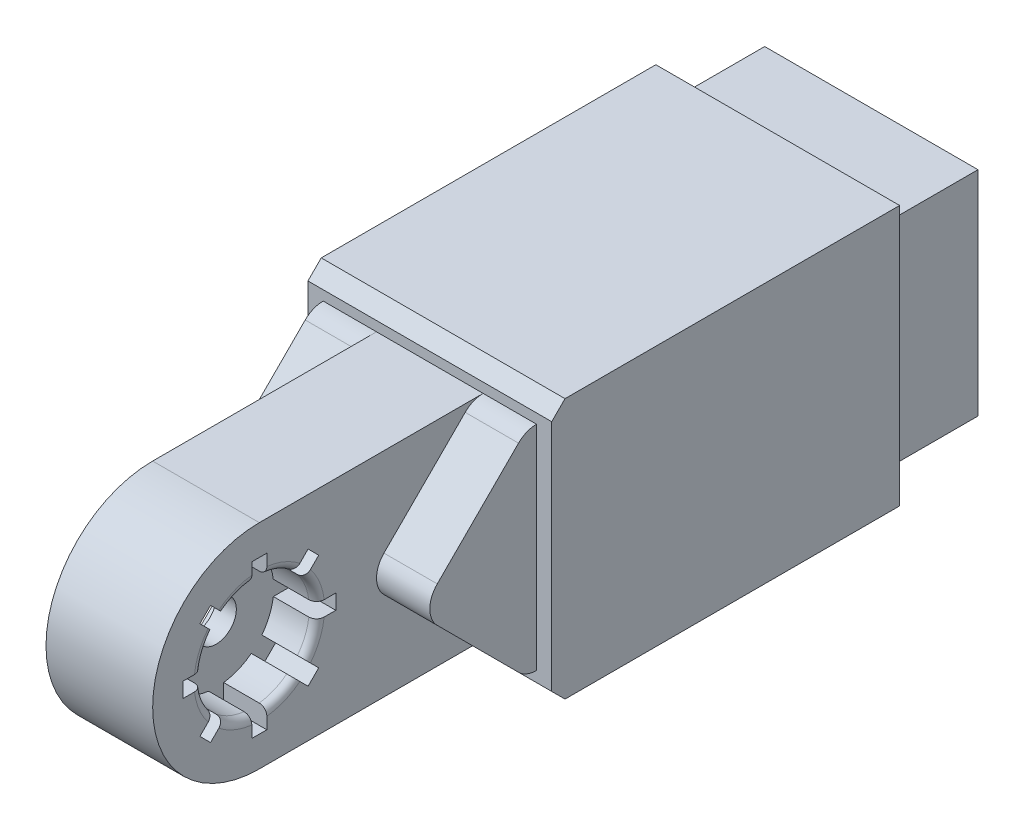
from build123d import *

# Parameters (mm, degrees)
SKETCH2_W                = 42
SKETCH2_H                = 42
BOSS_EXTRUDE1_DEPTH      = 89
SKETCH3_W                = 21
SKETCH3_H                = 42
BOSS_EXTRUDE2_DEPTH      = 42
BOSS_EXTRUDE3_DEPTH      = 21
SKETCH9_R                = 11.35
CUT_EXTRUDE2_DEPTH       = 8.5
CUT_EXTRUDE3_START       = -8.5
SKETCH11_R               = 11.35
CUT_EXTRUDE3_DEPTH       = 8.5
SKETCH12_R               = 3.975
CUT_EXTRUDE4_DEPTH       = 156.157984003
BOSS_EXTRUDE4_DEPTH      = 10.5
BOSS_EXTRUDE4_DEPTH_BACK = 31.5
FILLET1_R                = 5
FILLET2_R                = 5
FILLET3_R                = 5
FILLET4_R                = 5
FILLET5_R                = 5
FILLET6_R                = 5
FILLET7_R                = 1.5
FILLET8_R                = 1.5
SKETCH21_W               = 2.95860585
SKETCH21_H               = 4.417
CUT_EXTRUDE5_DEPTH       = 8.5
CIRPATTERN2_COUNT        = 8
MIRROR1_COPY_1_SKETCH_W  = 2.95860585
MIRROR1_COPY_1_SKETCH_H  = 4.417
MIRROR1_COPY_1_DEPTH     = 8.5
MIRROR1_COPY_2_SKETCH_W  = 2.95860585
MIRROR1_COPY_2_SKETCH_H  = 4.417
MIRROR1_COPY_2_DEPTH     = 8.5
MIRROR1_COPY_3_SKETCH_W  = 2.95860585
MIRROR1_COPY_3_SKETCH_H  = 4.417
MIRROR1_COPY_3_DEPTH     = 8.5
MIRROR1_COPY_4_SKETCH_W  = 2.95860585
MIRROR1_COPY_4_SKETCH_H  = 4.417
MIRROR1_COPY_4_DEPTH     = 8.5
MIRROR1_COPY_5_SKETCH_W  = 2.95860585
MIRROR1_COPY_5_SKETCH_H  = 4.417
MIRROR1_COPY_5_DEPTH     = 8.5
MIRROR1_COPY_6_SKETCH_W  = 2.95860585
MIRROR1_COPY_6_SKETCH_H  = 4.417
MIRROR1_COPY_6_DEPTH     = 8.5
MIRROR1_COPY_7_SKETCH_W  = 2.95860585
MIRROR1_COPY_7_SKETCH_H  = 4.417
MIRROR1_COPY_7_DEPTH     = 8.5
MIRROR1_COPY_8_SKETCH_W  = 2.95860585
MIRROR1_COPY_8_SKETCH_H  = 4.417
MIRROR1_COPY_8_DEPTH     = 8.5
SKETCH24_W               = 86.928932188
SKETCH24_H               = 4.545220174
SKETCH24_H_2             = 4.689106432
BOSS_EXTRUDE6_DEPTH      = 42
SKETCH25_W               = 68.5
SKETCH25_H               = 51.234326606
BOSS_EXTRUDE7_DEPTH      = 3
SKETCH28_W               = 68.5
SKETCH28_H               = 51.234326606
BOSS_EXTRUDE8_DEPTH      = 3
SKETCH30_W               = 62
SKETCH30_H               = 41.004326606
CUT_EXTRUDE6_DEPTH       = 45
SKETCH31_W               = 18.428932188
SKETCH31_H               = 4.615
CUT_EXTRUDE7_DEPTH       = 161.589321529
CHAMFER1_SIZE            = 1.5
SKETCH32_W               = 30
SKETCH32_H               = 30
CUT_EXTRUDE8_DEPTH       = 16.8
SKETCH33_R               = 5
CUT_EXTRUDE9_DEPTH       = 16.8
CUT_EXTRUDE10_DEPTH      = 162.455660134


with BuildPart() as part:
    # Sketch2 → Boss-Extrude1 (new body)
    with BuildSketch(Plane.XY):
        Rectangle(SKETCH2_W, SKETCH2_H)
    extrude(amount=BOSS_EXTRUDE1_DEPTH)

    # Sketch3 → Boss-Extrude2 (add)
    with BuildSketch(Plane.XY.offset(89)):
        Rectangle(SKETCH3_W, SKETCH3_H)
    extrude(amount=BOSS_EXTRUDE2_DEPTH)

    # Sketch8 → Boss-Extrude3 (add)
    with BuildSketch(Plane.ZY.offset(10.5)):
        with BuildLine():
            Line((131, 21), (131, -21))
            ThreePointArc((131, -21), (152, 0), (131, 21))
        make_face()
    extrude(amount=-BOSS_EXTRUDE3_DEPTH)

    # Sketch9 → Cut-Extrude2 (cut)
    with BuildSketch(Plane.ZY.offset(10.5)):
        with Locations((131, 0)):
            Circle(SKETCH9_R)
    extrude(amount=-CUT_EXTRUDE2_DEPTH, mode=Mode.SUBTRACT)

    # Sketch11 → Cut-Extrude3 (cut)
    with BuildSketch(Plane(origin=(10.5, 0, 0), x_dir=(0, 0, -1), z_dir=(1, 0, 0)).offset(CUT_EXTRUDE3_START)):
        with Locations((-131, 0)):
            Circle(SKETCH11_R)
    extrude(amount=CUT_EXTRUDE3_DEPTH, mode=Mode.SUBTRACT)

    # Sketch12 → Cut-Extrude4 (cut, through all)
    with BuildSketch(Plane.ZY.offset(2)):
        with Locations((131, 0)):
            Circle(SKETCH12_R)
    extrude(amount=-CUT_EXTRUDE4_DEPTH, mode=Mode.SUBTRACT)

    # Sketch20 → Boss-Extrude4 (add, two sides: drawn at the far end of the back side and taken through both)
    with BuildSketch(Plane.ZY.offset(10.5).offset(-BOSS_EXTRUDE4_DEPTH_BACK)):
        Polygon((89, -21), (110, 0), (89, 21), align=None)
    extrude(amount=BOSS_EXTRUDE4_DEPTH + BOSS_EXTRUDE4_DEPTH_BACK)

    # Fillet1
    fillet1_edges = [part.edges().sort_by_distance(p)[0] for p in [
        (15.75, 0, 110),
    ]]
    fillet(fillet1_edges, radius=FILLET1_R)

    # Fillet2
    fillet2_edges = [part.edges().sort_by_distance(p)[0] for p in [
        (-15.75, 0, 110),
    ]]
    fillet(fillet2_edges, radius=FILLET2_R)

    # Fillet3
    fillet3_edges = [part.edges().sort_by_distance(p)[0] for p in [
        (-15.75, -21, 89),
    ]]
    fillet(fillet3_edges, radius=FILLET3_R)

    # Fillet4
    fillet4_edges = [part.edges().sort_by_distance(p)[0] for p in [
        (-15.75, 21, 89),
    ]]
    fillet(fillet4_edges, radius=FILLET4_R)

    # Fillet5
    fillet5_edges = [part.edges().sort_by_distance(p)[0] for p in [
        (15.75, -21, 89),
    ]]
    fillet(fillet5_edges, radius=FILLET5_R)

    # Fillet6
    fillet6_edges = [part.edges().sort_by_distance(p)[0] for p in [
        (15.75, 21, 89),
    ]]
    fillet(fillet6_edges, radius=FILLET6_R)

    # Fillet7
    fillet7_edges = [part.edges().sort_by_distance(p)[0] for p in [
        (-10.5, 0, 119.65),
    ]]
    fillet(fillet7_edges, radius=FILLET7_R)

    # Fillet8
    fillet8_edges = [part.edges().sort_by_distance(p)[0] for p in [
        (10.5, 0, 142.35),
    ]]
    fillet(fillet8_edges, radius=FILLET8_R)

    # Sketch21 → Cut-Extrude5 (cut)
    with BuildSketch(Plane.ZY.offset(10.5)):
        with Locations((131, 12.85)):
            Rectangle(SKETCH21_W, SKETCH21_H)
    cut_extrude5 = extrude(amount=-CUT_EXTRUDE5_DEPTH, mode=Mode.SUBTRACT)

    # CirPattern2: Cut-Extrude5 ×8 about axis
    cirpattern2_axis = Axis((-9, 0, 131), (-1, 0, 0))
    for i in range(1, CIRPATTERN2_COUNT):
        add(cut_extrude5.rotate(cirpattern2_axis, i * 360 / CIRPATTERN2_COUNT), mode=Mode.SUBTRACT)

    # Mirror1 copy 1 sketch → Mirror1 copy 1 (cut)
    with BuildSketch(Plane(origin=(10.5, -92.630988335, 38.369011665), x_dir=(0, 0.7071067811865475, 0.7071067811865476), z_dir=(1, 0, 0))):
        with Locations((131, -12.85)):
            Rectangle(MIRROR1_COPY_1_SKETCH_W, MIRROR1_COPY_1_SKETCH_H)
    extrude(amount=-MIRROR1_COPY_1_DEPTH, mode=Mode.SUBTRACT)

    # Mirror1 copy 2 sketch → Mirror1 copy 2 (cut)
    with BuildSketch(Plane(origin=(10.5, -131, 131), x_dir=(0, 1, 0), z_dir=(1, 0, 0))):
        with Locations((131, -12.85)):
            Rectangle(MIRROR1_COPY_2_SKETCH_W, MIRROR1_COPY_2_SKETCH_H)
    extrude(amount=-MIRROR1_COPY_2_DEPTH, mode=Mode.SUBTRACT)

    # Mirror1 copy 3 sketch → Mirror1 copy 3 (cut)
    with BuildSketch(Plane(origin=(10.5, -92.630988335, 223.630988335), x_dir=(0, 0.7071067811865476, -0.7071067811865475), z_dir=(1, 0, 0))):
        with Locations((131, -12.85)):
            Rectangle(MIRROR1_COPY_3_SKETCH_W, MIRROR1_COPY_3_SKETCH_H)
    extrude(amount=-MIRROR1_COPY_3_DEPTH, mode=Mode.SUBTRACT)

    # Mirror1 copy 4 sketch → Mirror1 copy 4 (cut)
    with BuildSketch(Plane(origin=(10.5, 0, 262), x_dir=(0, 0, -1), z_dir=(1, 0, 0))):
        with Locations((131, -12.85)):
            Rectangle(MIRROR1_COPY_4_SKETCH_W, MIRROR1_COPY_4_SKETCH_H)
    extrude(amount=-MIRROR1_COPY_4_DEPTH, mode=Mode.SUBTRACT)

    # Mirror1 copy 5 sketch → Mirror1 copy 5 (cut)
    with BuildSketch(Plane(origin=(10.5, 92.630988335, 223.630988335), x_dir=(0, -0.7071067811865475, -0.7071067811865477), z_dir=(1, 0, 0))):
        with Locations((131, -12.85)):
            Rectangle(MIRROR1_COPY_5_SKETCH_W, MIRROR1_COPY_5_SKETCH_H)
    extrude(amount=-MIRROR1_COPY_5_DEPTH, mode=Mode.SUBTRACT)

    # Mirror1 copy 6 sketch → Mirror1 copy 6 (cut)
    with BuildSketch(Plane(origin=(10.5, 131, 131), x_dir=(0, -1, 0), z_dir=(1, 0, 0))):
        with Locations((131, -12.85)):
            Rectangle(MIRROR1_COPY_6_SKETCH_W, MIRROR1_COPY_6_SKETCH_H)
    extrude(amount=-MIRROR1_COPY_6_DEPTH, mode=Mode.SUBTRACT)

    # Mirror1 copy 7 sketch → Mirror1 copy 7 (cut)
    with BuildSketch(Plane(origin=(10.5, 92.630988335, 38.369011665), x_dir=(0, -0.7071067811865477, 0.7071067811865474), z_dir=(1, 0, 0))):
        with Locations((131, -12.85)):
            Rectangle(MIRROR1_COPY_7_SKETCH_W, MIRROR1_COPY_7_SKETCH_H)
    extrude(amount=-MIRROR1_COPY_7_DEPTH, mode=Mode.SUBTRACT)

    # Mirror1 copy 8 sketch → Mirror1 copy 8 (cut)
    with BuildSketch(Plane(origin=(10.5, 0, 0), x_dir=(0, 0, 1), z_dir=(1, 0, 0))):
        with Locations((131, -12.85)):
            Rectangle(MIRROR1_COPY_8_SKETCH_W, MIRROR1_COPY_8_SKETCH_H)
    extrude(amount=-MIRROR1_COPY_8_DEPTH, mode=Mode.SUBTRACT)

    # Sketch24 → Boss-Extrude6 (add)
    with BuildSketch(Plane(origin=(21, 0, 0), x_dir=(0, 0, -1), z_dir=(1, 0, 0))):
        with Locations((-43.464466094, 23.272610087)):
            Rectangle(SKETCH24_W, SKETCH24_H)
        with Locations((-43.464466094, -23.344553216)):
            Rectangle(SKETCH24_W, SKETCH24_H_2)
    extrude(amount=-BOSS_EXTRUDE6_DEPTH)

    # Sketch25 → Boss-Extrude7 (add)
    with BuildSketch(Plane(origin=(21, 0, 0), x_dir=(0, 0, -1), z_dir=(1, 0, 0))):
        with Locations((-52.678932188, -0.071943129)):
            Rectangle(SKETCH25_W, SKETCH25_H)
    extrude(amount=BOSS_EXTRUDE7_DEPTH)

    # Sketch28 → Boss-Extrude8 (add)
    with BuildSketch(Plane.ZY.offset(21)):
        with Locations((52.678932188, -0.071943129)):
            Rectangle(SKETCH28_W, SKETCH28_H)
    extrude(amount=BOSS_EXTRUDE8_DEPTH)

    # Sketch30 → Cut-Extrude6 (cut)
    with BuildSketch(Plane.ZY.offset(24)):
        with Locations((50.928932188, -0.071943129)):
            Rectangle(SKETCH30_W, SKETCH30_H)
    extrude(amount=-CUT_EXTRUDE6_DEPTH, mode=Mode.SUBTRACT)

    # Sketch31 → Cut-Extrude7 (cut, through all)
    with BuildSketch(Plane(origin=(21, 0, 0), x_dir=(0, 0, -1), z_dir=(1, 0, 0))):
        with Locations((-9.214466094, -23.381606432)):
            Rectangle(SKETCH31_W, SKETCH31_H)
        with Locations((-9.214466094, 23.237720174)):
            Rectangle(SKETCH31_W, SKETCH31_H)
    extrude(amount=-CUT_EXTRUDE7_DEPTH, mode=Mode.SUBTRACT)

    # Chamfer1
    chamfer1_edges = [part.edges().sort_by_distance(p)[0] for p in [
        (0, 20.930220174, 18.428932188),
        (21, -0.071943129, 18.428932188),
        (0, -21.074106432, 18.428932188),
        (-21, -0.071943129, 18.428932188),
    ]]
    chamfer(chamfer1_edges, length=CHAMFER1_SIZE)

    # Sketch32 → Cut-Extrude8 (cut)
    with BuildSketch(Plane(origin=(0, 0, 0), x_dir=(-1, 0, 0), z_dir=(0, 0, -1))):
        Rectangle(SKETCH32_W, SKETCH32_H)
    extrude(amount=-CUT_EXTRUDE8_DEPTH, mode=Mode.SUBTRACT)

    # Sketch33 → Cut-Extrude9 (cut)
    with BuildSketch(Plane.XY.offset(19.928932188)):
        Circle(SKETCH33_R)
    extrude(amount=-CUT_EXTRUDE9_DEPTH, mode=Mode.SUBTRACT)

    # Sketch34 → Cut-Extrude10 (cut, through all)
    with BuildSketch(Plane.ZY.offset(24)):
        Polygon((88.330412389, -21.669587611), (88.330412389, -28.222069099), (81.777930901, -28.222069099), align=None)
        Polygon((88.330412389, 28.078182842), (81.777930901, 28.078182842), (88.330412389, 21.525701354), align=None)
    extrude(amount=-CUT_EXTRUDE10_DEPTH, mode=Mode.SUBTRACT)


solid = part.part
